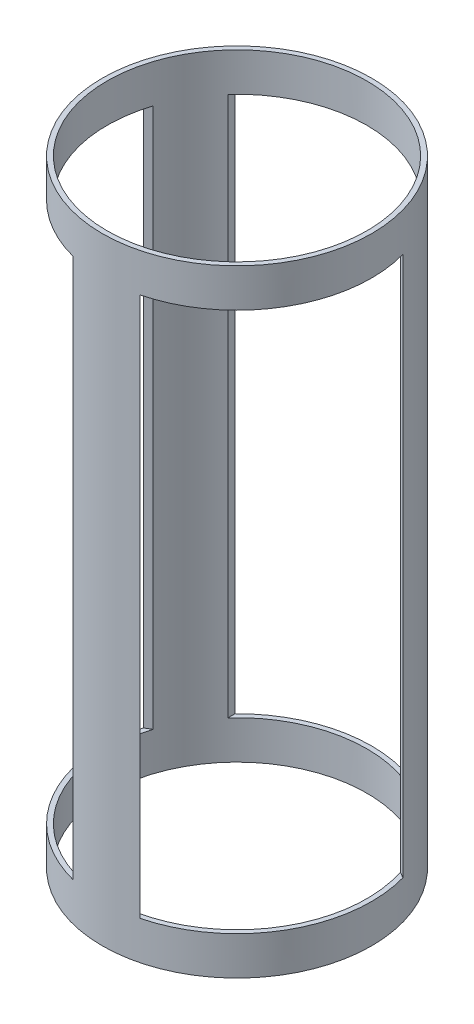
from build123d import *

# Parameters (mm, degrees)
SKETCH1_R               = 88.9
SKETCH1_R_2             = 85.725
BOSS_EXTRUDE1_DEPTH     = 203.581
CUT_EXTRUDE1_REACH      = 241.273
CUT_EXTRUDE1_END_RADIUS = 88.9
SKETCH2_W               = 127
SKETCH2_H               = 356.362
CIRPATTERN1_COUNT       = 3


with BuildPart() as part:
    # Sketch1 → Boss-Extrude1 (new, symmetric)
    with BuildSketch(Plane(origin=(0, 0, 0), x_dir=(1, 0, 0), z_dir=(0, 1, 0))):
        Circle(SKETCH1_R)
        Circle(SKETCH1_R_2, mode=Mode.SUBTRACT)
    extrude(amount=BOSS_EXTRUDE1_DEPTH, both=True)

    # Cut-Extrude1: up to this cylinder (the profile starts inside it)
    cut_extrude1_end = Plane(origin=(0, 0, 0), z_dir=(0, -1, 0)) * Cylinder(CUT_EXTRUDE1_END_RADIUS, 661.346, mode=Mode.PRIVATE)
    # Sketch2 → Cut-Extrude1 (cut, up to the surface)
    with BuildSketch(Plane.XY, mode=Mode.PRIVATE) as cut_extrude1_sk1:
        Rectangle(SKETCH2_W, SKETCH2_H)
    cut_extrude1_tool1 = extrude(cut_extrude1_sk1.sketch, amount=-CUT_EXTRUDE1_REACH, mode=Mode.PRIVATE) & cut_extrude1_end
    cut_extrude1 = cut_extrude1_tool1.solids().sort_by_distance((0, 0, 0))[0]
    add(cut_extrude1, mode=Mode.SUBTRACT)

    # CirPattern1: Cut-Extrude1 ×3 about axis
    cirpattern1_axis = Axis((0, 203.581, 0), (0, -1, 0))
    for i in range(1, CIRPATTERN1_COUNT):
        add(cut_extrude1.rotate(cirpattern1_axis, i * 360 / CIRPATTERN1_COUNT), mode=Mode.SUBTRACT)


solid = part.part
